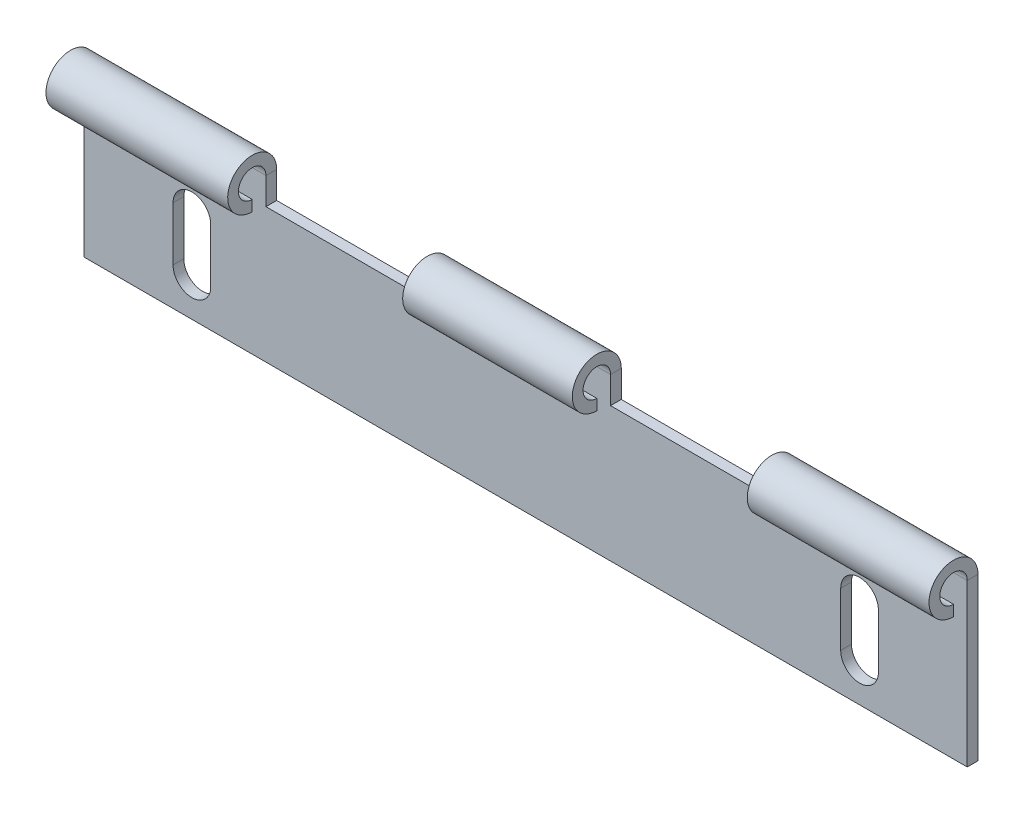
from build123d import *

# Parameters (mm, degrees)
BASIS_BLECH1_DEPTH       = 2
BLECHKANTENRAND1_START   = -82
BLECHKANTENRAND1_DEPTH   = 33.75
BLECHKANTENRAND1_START_2 = 48.25
BLECHKANTENRAND1_2_DEPTH = 33.75
BLECHKANTENRAND1_START_3 = -15.75
BLECHKANTENRAND1_3_DEPTH = 31.5


# Read off the part's stored shape, not the designer's step: Blechkantenrand1
# Sheet-metal steps are written as plain solids
with BuildPart() as part:
    # Skizze1 → Basis-Blech1 (new body)
    with BuildSketch(Plane.XY):
        Polygon((-82, 12.5), (-82, 17.5), (-48.25, 17.5), (-48.25, 12.5), (-15.75, 12.5), (-15.75, 17.5), (15.75, 17.5), (15.75, 12.5), (48.25, 12.5), (48.25, 17.5), (82, 17.5), (82, 12.5), (82, -12.5), (-82, -12.5), align=None)
        with BuildLine():
            Line((-58.5, 4.5), (-58.5, -5.5))
            ThreePointArc((-58.5, -5.5), (-62, -9), (-65.5, -5.5))
            Line((-65.5, -5.5), (-65.5, 4.5))
            ThreePointArc((-65.5, 4.5), (-62, 8), (-58.5, 4.5))
        make_face(mode=Mode.SUBTRACT)
        with BuildLine():
            Line((65.5, 4.5), (65.5, -5.5))
            ThreePointArc((65.5, -5.5), (62, -9), (58.5, -5.5))
            Line((58.5, -5.5), (58.5, 4.5))
            ThreePointArc((58.5, 4.5), (62, 8), (65.5, 4.5))
        make_face(mode=Mode.SUBTRACT)
    extrude(amount=-BASIS_BLECH1_DEPTH)

    # Blechkantenrand1 outline → Blechkantenrand1 (add)
    with BuildSketch(Plane.YZ.offset(BLECHKANTENRAND1_START)):
        with BuildLine():
            Line((12.95, 2.55), (14.95, 2.55))
            ThreePointArc((14.95, 2.55), (19.303122292, 4.353122292), (17.5, 0))
            Line((17.5, 0), (17.5, -2))
            ThreePointArc((17.5, -2), (20.717335854, 5.767335854), (12.95, 2.55))
        make_face()
    extrude(amount=BLECHKANTENRAND1_DEPTH)

    # Blechkantenrand1 2 outline → Blechkantenrand1 2 (add)
    with BuildSketch(Plane.YZ.offset(BLECHKANTENRAND1_START_2)):
        with BuildLine():
            Line((12.95, 2.55), (14.95, 2.55))
            ThreePointArc((14.95, 2.55), (19.303122292, 4.353122292), (17.5, 0))
            Line((17.5, 0), (17.5, -2))
            ThreePointArc((17.5, -2), (20.717335854, 5.767335854), (12.95, 2.55))
        make_face()
    extrude(amount=BLECHKANTENRAND1_2_DEPTH)

    # Blechkantenrand1 3 outline → Blechkantenrand1 3 (add)
    with BuildSketch(Plane.YZ.offset(BLECHKANTENRAND1_START_3)):
        with BuildLine():
            Line((12.95, 2.55), (14.95, 2.55))
            ThreePointArc((14.95, 2.55), (19.303122292, 4.353122292), (17.5, 0))
            Line((17.5, 0), (17.5, -2))
            ThreePointArc((17.5, -2), (20.717335854, 5.767335854), (12.95, 2.55))
        make_face()
    extrude(amount=BLECHKANTENRAND1_3_DEPTH)


solid = part.part
